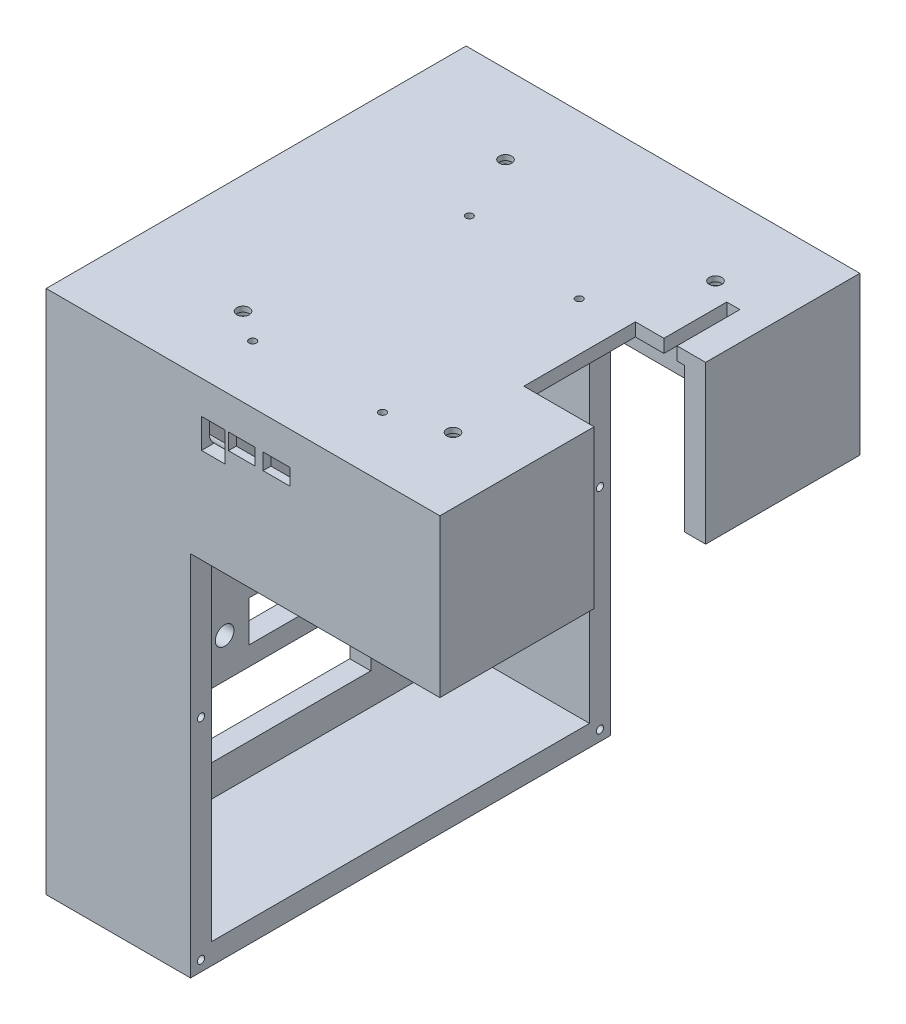
from build123d import *

# Parameters (mm, degrees)
BOSS_EXTRUDE1_DEPTH      = 50
BOSS_EXTRUDE1_DEPTH_BACK = 10
SKETCH1_W                = 150
SKETCH1_H                = 160
CUT_EXTRUDE1_DEPTH       = 45
CUT_EXTRUDE1_DEPTH_BACK  = 10
SKETCH3_W                = 134
SKETCH3_H                = 144
SKETCH4_W                = 160
SKETCH4_H                = 140
BOSS_EXTRUDE2_DEPTH      = 55
SKETCH7_W                = 144
SKETCH7_H                = 132
CUT_EXTRUDE3_DEPTH       = 47
SKETCH12_R               = 1.375
CUT_EXTRUDE4_DEPTH       = 6
SKETCH13_R               = 1.375
CUT_EXTRUDE5_DEPTH       = 6
SKETCH16_R               = 1.375
CUT_EXTRUDE6_DEPTH       = 6
SKETCH17_W               = 9
SKETCH17_H               = 11.25
SKETCH17_W_2             = 10.2
SKETCH17_H_2             = 6.2
CUT_EXTRUDE7_DEPTH       = 5
SKETCH18_R               = 3.55
SKETCH18_R_2             = 2.6
SKETCH18_R_3             = 2.35
SKETCH18_W               = 71.34
SKETCH18_H               = 24.5
SKETCH18_W_2             = 21.5
SKETCH18_H_2             = 15.5
CUT_EXTRUDE8_DEPTH       = 15
SKETCH20_W               = 51.644409869
SKETCH20_H               = 15
CUT_EXTRUDE9_DEPTH       = 5
FILLET3_R                = 5
SKETCH21_R               = 2.375
CUT_EXTRUDE10_DEPTH      = 10
SKETCH22_R               = 4.95
SKETCH22_R_2             = 1.375
CUT_EXTRUDE11_DEPTH      = 3
SKETCH23_R               = 1.375
CUT_EXTRUDE12_DEPTH      = 5
SKETCH25_W               = 42.5
SKETCH25_H               = 42.5
CUT_EXTRUDE13_DEPTH      = 60
SKETCH26_W               = 5
SKETCH26_H               = 24
CUT_EXTRUDE14_DEPTH      = 5


with BuildPart() as part:
    # Sketch1 → Boss-Extrude1 (new, two sides: drawn at the far end of the back side and taken through both)
    with BuildSketch(Plane(origin=(0, 0, 0), x_dir=(1, 0, 0), z_dir=(0, 1, 0)).offset(-BOSS_EXTRUDE1_DEPTH_BACK)):
        Rectangle(SKETCH1_W, SKETCH1_H)
    extrude(amount=BOSS_EXTRUDE1_DEPTH + BOSS_EXTRUDE1_DEPTH_BACK)

    # Sketch3 → Cut-Extrude1 (cut, two sides: drawn at the far end of the back side and taken through both)
    with BuildSketch(Plane(origin=(0, 0, 0), x_dir=(1, 0, 0), z_dir=(0, 1, 0)).offset(-CUT_EXTRUDE1_DEPTH_BACK)):
        Rectangle(SKETCH3_W, SKETCH3_H)
    extrude(amount=CUT_EXTRUDE1_DEPTH + CUT_EXTRUDE1_DEPTH_BACK, mode=Mode.SUBTRACT)

    # Sketch4 → Boss-Extrude2 (add)
    with BuildSketch(Plane.ZY.offset(75)):
        with Locations((0, -80)):
            Rectangle(SKETCH4_W, SKETCH4_H)
    extrude(amount=-BOSS_EXTRUDE2_DEPTH)

    # Sketch7 → Cut-Extrude3 (cut)
    with BuildSketch(Plane(origin=(-20, 0, 0), x_dir=(0, 0, -1), z_dir=(1, 0, 0))):
        with Locations((0, -76)):
            Rectangle(SKETCH7_W, SKETCH7_H)
    extrude(amount=-CUT_EXTRUDE3_DEPTH, mode=Mode.SUBTRACT)

    # Sketch12 → Cut-Extrude4 (cut)
    with BuildSketch(Plane(origin=(-20, 0, 0), x_dir=(0, 0, -1), z_dir=(1, 0, 0))):
        with Locations((-76, -146)):
            Circle(SKETCH12_R)
        with Locations((76, -146)):
            Circle(SKETCH12_R)
        with Locations((76, -66)):
            Circle(SKETCH12_R)
        with Locations((-76, -66)):
            Circle(SKETCH12_R)
    extrude(amount=-CUT_EXTRUDE4_DEPTH, mode=Mode.SUBTRACT)

    # Sketch13 → Cut-Extrude5 (cut)
    with BuildSketch(Plane(origin=(0, -10, 0), x_dir=(-1, 0, 0), z_dir=(0, -1, 0))):
        with Locations(Location((-71, 76, 0), (0, 0, 90))):
            Circle(SKETCH13_R)
        with Locations(Location((-6, 76, 0), (0, 0, 90))):
            Circle(SKETCH13_R)
        with Locations(Location((-6, -76, 0), (0, 0, 90))):
            Circle(SKETCH13_R)
        with Locations(Location((-71, -76, 0), (0, 0, 90))):
            Circle(SKETCH13_R)
    extrude(amount=-CUT_EXTRUDE5_DEPTH, mode=Mode.SUBTRACT)

    # Sketch16 → Cut-Extrude6 (cut)
    with BuildSketch(Plane(origin=(0, 45, 0), x_dir=(-1, 0, 0), z_dir=(0, -1, 0))):
        with Locations(Location((18.319208848, -58, 0), (0, 0, 90))):
            Circle(SKETCH16_R)
        with Locations(Location((18.319208848, 24.55, 0), (0, 0, 90))):
            Circle(SKETCH16_R)
        with Locations(Location((-29.940791152, -56.8, 0), (0, 0, 90))):
            Circle(SKETCH16_R)
        with Locations(Location((-29.940791152, 18.13, 0), (0, 0, 90))):
            Circle(SKETCH16_R)
    extrude(amount=-CUT_EXTRUDE6_DEPTH, mode=Mode.SUBTRACT)

    # Sketch17 → Cut-Extrude7 (cut)
    with BuildSketch(Plane.XY.offset(80)):
        with Locations((-11.319208848, 31.775)):
            Rectangle(SKETCH17_W, SKETCH17_H)
        with Locations((12.730791152, 34.3)):
            Rectangle(SKETCH17_W_2, SKETCH17_H_2)
        with Locations((-0.469208848, 34.3)):
            Rectangle(SKETCH17_W_2, SKETCH17_H_2)
    extrude(amount=-CUT_EXTRUDE7_DEPTH, mode=Mode.SUBTRACT)

    # Sketch18 → Cut-Extrude8 (cut)
    with BuildSketch(Plane.ZY.offset(75)):
        with Locations((20, -90.5)):
            Circle(SKETCH18_R)
        with Locations((-19.79104036, -90.5)):
            Circle(SKETCH18_R_2)
        with Locations((0, -15)):
            Circle(SKETCH18_R_3)
        with Locations((0, -117.75)):
            Rectangle(SKETCH18_W, SKETCH18_H)
        with Locations((0, -90.5)):
            Rectangle(SKETCH18_W_2, SKETCH18_H_2)
    extrude(amount=-CUT_EXTRUDE8_DEPTH, mode=Mode.SUBTRACT)

    # Sketch20 → Cut-Extrude9 (cut)
    with BuildSketch(Plane(origin=(0, 0, 72), x_dir=(-1, 0, 0), z_dir=(0, 0, -1))):
        with Locations((-5.002996086, 32.5)):
            Rectangle(SKETCH20_W, SKETCH20_H)
    extrude(amount=-CUT_EXTRUDE9_DEPTH, mode=Mode.SUBTRACT)

    # Fillet3
    # the kernel refuses this fillet: 5 mm, written as the material it adds along each edge
    with BuildSketch(Plane(origin=(-33.319208848, 25, 77), x_dir=(0, 1, 0), z_dir=(1, 0, 0))) as fillet3_piece_1_section:
        with BuildLine():
            CenterArc((FILLET3_R, -FILLET3_R), FILLET3_R, 90, 90)
            Line((0, -FILLET3_R), (0, 0))
            Line((0, 0), (FILLET3_R, 0))
        make_face()
    fillet3_piece_1 = extrude(amount=76.644409869, mode=Mode.PRIVATE)
    fillet3_piece_1 = split(fillet3_piece_1, bisect_by=Plane(origin=(-15.819208848, 27.074193892, 76.479369386), z_dir=(-1, 0, 0)), keep=Keep.TOP, mode=Mode.PRIVATE)
    add(fillet3_piece_1)
    with BuildSketch(Plane(origin=(-33.319208848, 25, 77), x_dir=(0, 1, 0), z_dir=(1, 0, 0))) as fillet3_piece_2_section:
        with BuildLine():
            CenterArc((FILLET3_R, -FILLET3_R), FILLET3_R, 90, 90)
            Line((0, -FILLET3_R), (0, 0))
            Line((0, 0), (FILLET3_R, 0))
        make_face()
    fillet3_piece_2 = extrude(amount=76.644409869, mode=Mode.PRIVATE)
    fillet3_piece_2 = split(fillet3_piece_2, bisect_by=Plane(origin=(-11.319208848, 26.15, 75.492647352), z_dir=(0, -1, 0)), keep=Keep.TOP, mode=Mode.PRIVATE)
    add(fillet3_piece_2)
    with BuildSketch(Plane(origin=(-33.319208848, 25, 77), x_dir=(0, 1, 0), z_dir=(1, 0, 0))) as fillet3_piece_3_section:
        with BuildLine():
            CenterArc((FILLET3_R, -FILLET3_R), FILLET3_R, 90, 90)
            Line((0, -FILLET3_R), (0, 0))
            Line((0, 0), (FILLET3_R, 0))
        make_face()
    fillet3_piece_3 = extrude(amount=76.644409869, mode=Mode.PRIVATE)
    fillet3_piece_3 = split(fillet3_piece_3, bisect_by=Plane(origin=(-6.819208848, 27.074193892, 76.479369386), z_dir=(1, 0, 0)), keep=Keep.TOP, mode=Mode.PRIVATE)
    add(fillet3_piece_3)

    # Sketch21 → Cut-Extrude10 (cut)
    with BuildSketch(Plane(origin=(0, 50, 0), x_dir=(1, 0, 0), z_dir=(0, 1, 0))):
        with Locations(Location((50, 50, 0), (0, 0, 270))):
            Circle(SKETCH21_R)
        with Locations(Location((-30, 50, 0), (0, 0, 270))):
            Circle(SKETCH21_R)
        with Locations(Location((-30, -50, 0), (0, 0, 270))):
            Circle(SKETCH21_R)
        with Locations(Location((50, -50, 0), (0, 0, 270))):
            Circle(SKETCH21_R)
    extrude(amount=-CUT_EXTRUDE10_DEPTH, mode=Mode.SUBTRACT)

    # Sketch22 → Cut-Extrude11 (cut)
    with BuildSketch(Plane.XZ.offset(-45)):
        with Locations(Location((-30, 50, 0), (0, 0, 270))):
            Circle(SKETCH22_R)
        with Locations(Location((50, 50, 0), (0, 0, 270))):
            Circle(SKETCH22_R)
        with Locations(Location((50, -50, 0), (0, 0, 270))):
            Circle(SKETCH22_R)
        with Locations(Location((-30, -50, 0), (0, 0, 270))):
            Circle(SKETCH22_R)
        with Locations(Location((-37, 40, 0), (0, 0, 270))):
            Circle(SKETCH22_R_2)
        with Locations(Location((53, 40, 0), (0, 0, 270))):
            Circle(SKETCH22_R_2)
        with Locations(Location((53, -40, 0), (0, 0, 270))):
            Circle(SKETCH22_R_2)
        with Locations(Location((-37, -40, 0), (0, 0, 270))):
            Circle(SKETCH22_R_2)
    extrude(amount=-CUT_EXTRUDE11_DEPTH, mode=Mode.SUBTRACT)

    # Sketch23 → Cut-Extrude12 (cut)
    with BuildSketch(Plane(origin=(-67, 0, 0), x_dir=(0, 0, -1), z_dir=(1, 0, 0))):
        with Locations((53, -137)):
            Circle(SKETCH23_R)
        with Locations((-53, -137)):
            Circle(SKETCH23_R)
        with Locations((-53, 3)):
            Circle(SKETCH23_R)
        with Locations((53, 3)):
            Circle(SKETCH23_R)
    extrude(amount=-CUT_EXTRUDE12_DEPTH, mode=Mode.SUBTRACT)

    # Sketch25 → Cut-Extrude13 (cut)
    with BuildSketch(Plane.XZ.offset(10)):
        with Locations((69.5, 0)):
            Rectangle(SKETCH25_W, SKETCH25_H)
    extrude(amount=-CUT_EXTRUDE13_DEPTH, mode=Mode.SUBTRACT)

    # Sketch26 → Cut-Extrude14 (cut)
    with BuildSketch(Plane.XZ.offset(-45)):
        with Locations((61.60913212, -33.192475412)):
            Rectangle(SKETCH26_W, SKETCH26_H)
    extrude(amount=-CUT_EXTRUDE14_DEPTH, mode=Mode.SUBTRACT)


solid = part.part
